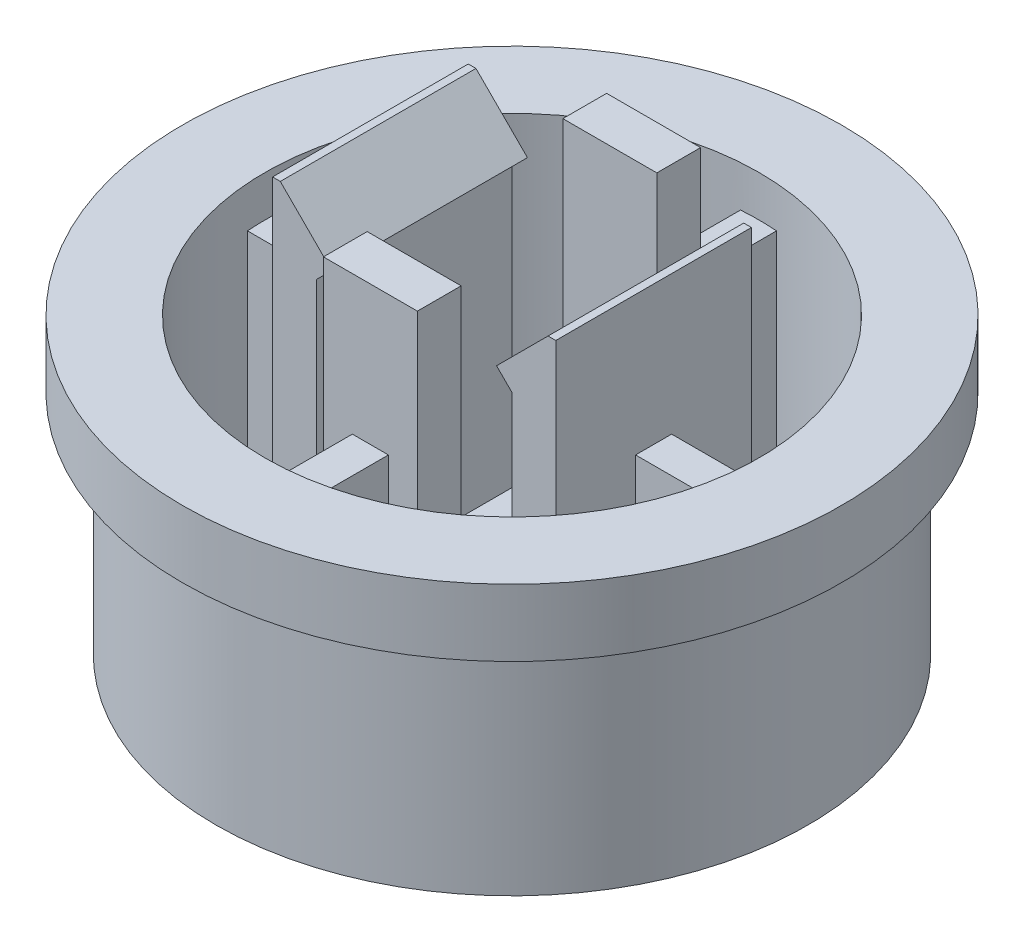
from build123d import *

# Parameters (mm, degrees)
SKETCH_1_R          = 5.75
EXTRUDE_1_DEPTH     = 0.9
SKETCH_2_R          = 5.75
SKETCH_2_R_2        = 4.8
EXTRUDE_2_DEPTH     = 3.5
SKETCH_3_R          = 6.4
SKETCH_3_R_2        = 4.8
EXTRUDE_3_DEPTH     = 1.3
SKETCH_4_W          = 0.85
SKETCH_4_H          = 3.8
SKETCH_4_W_2        = 1.824882422
SKETCH_4_H_2        = 0.85
EXTRUDE_4_DEPTH     = 6.7
EXTRUDE_5_DEPTH     = 3.8
CUT_EXTRUDE_1_REACH = 14.946
EXTRUDE_6_DEPTH     = 4


with BuildPart() as part:
    # Эскиз1 → Бобышка-Вытянуть1 (new body)
    with BuildSketch(Plane(origin=(0, 0, 0), x_dir=(1, 0, 0), z_dir=(0, 1, 0))):
        Circle(SKETCH_1_R)
    extrude(amount=EXTRUDE_1_DEPTH)

    # Эскиз2 → Бобышка-Вытянуть2 (add)
    with BuildSketch(Plane(origin=(0, 0.9, 0), x_dir=(1, 0, 0), z_dir=(0, 1, 0))):
        Circle(SKETCH_2_R)
        Circle(SKETCH_2_R_2, mode=Mode.SUBTRACT)
    extrude(amount=EXTRUDE_2_DEPTH)

    # Эскиз3 → Бобышка-Вытянуть3 (add)
    with BuildSketch(Plane(origin=(0, 4.4, 0), x_dir=(1, 0, 0), z_dir=(0, 1, 0))):
        Circle(SKETCH_3_R)
        Circle(SKETCH_3_R_2, mode=Mode.SUBTRACT)
    extrude(amount=EXTRUDE_3_DEPTH)

    # Эскиз4 → Бобышка-Вытянуть4 (add)
    with BuildSketch(Plane(origin=(0, 0.9, 0), x_dir=(1, 0, 0), z_dir=(0, 1, 0))):
        with Locations((-2.325, 0)):
            Rectangle(SKETCH_4_W, SKETCH_4_H)
        with Locations((2.325, 0)):
            Rectangle(SKETCH_4_W, SKETCH_4_H)
        with Locations((0, 2.325)):
            Rectangle(SKETCH_4_W_2, SKETCH_4_H_2)
        with Locations((0, -2.325)):
            Rectangle(SKETCH_4_W_2, SKETCH_4_H_2)
    extrude(amount=EXTRUDE_4_DEPTH)

    # Эскиз5 → Бобышка-Вытянуть5 (add)
    with BuildSketch(Plane(origin=(0, 0, -1.9), x_dir=(-1, 0, 0), z_dir=(0, 0, -1))):
        Polygon((1.9, 6.3), (1.6, 6.6), (2.6, 7.6), align=None)
        Polygon((-1.9, 6.3), (-1.6, 6.6), (-2.6, 7.6), align=None)
    extrude(amount=-EXTRUDE_5_DEPTH)

    # Эскиз6 → Вырез-Вытянуть1 (cut, up to next)
    with BuildSketch(Plane(origin=(0, 0, -1.9), x_dir=(-1, 0, 0), z_dir=(0, 0, -1)), mode=Mode.PRIVATE) as cut_extrude_1_sk1:
        Polygon((1.9, 6.9), (2.6, 7.6), (1.9, 7.6), align=None)
    cut_extrude_1_tool1 = extrude(cut_extrude_1_sk1.sketch, amount=-CUT_EXTRUDE_1_REACH, mode=Mode.PRIVATE) & part.part
    # Эскиз6 → Вырез-Вытянуть1 (cut, up to next)
    with BuildSketch(Plane(origin=(0, 0, -1.9), x_dir=(-1, 0, 0), z_dir=(0, 0, -1)), mode=Mode.PRIVATE) as cut_extrude_1_sk2:
        Polygon((-1.9, 6.9), (-2.6, 7.6), (-1.9, 7.6), align=None)
    cut_extrude_1_tool2 = extrude(cut_extrude_1_sk2.sketch, amount=-CUT_EXTRUDE_1_REACH, mode=Mode.PRIVATE) & part.part
    add(cut_extrude_1_tool1.solids().sort_by_distance((-2.133333, 7.366667, -1.9))[0], mode=Mode.SUBTRACT)
    add(cut_extrude_1_tool2.solids().sort_by_distance((2.133333, 7.366667, -1.9))[0], mode=Mode.SUBTRACT)

    # Эскиз7 → Бобышка-Вытянуть6 (add)
    with BuildSketch(Plane(origin=(0, 0.9, 0), x_dir=(1, 0, 0), z_dir=(0, 1, 0))):
        with BuildLine():
            Line((-0.35, -2.75), (0.35, -2.75))
            Line((0.35, -2.75), (0.35, -4.787222577))
            ThreePointArc((0.35, -4.787222577), (0, -4.8), (-0.35, -4.787222577))
            Line((-0.35, -4.787222577), (-0.35, -2.75))
        make_face()
        with BuildLine():
            Line((4.787222577, -0.35), (2.75, -0.35))
            Line((2.75, -0.35), (2.75, 0.35))
            Line((2.75, 0.35), (4.787222577, 0.35))
            ThreePointArc((4.787222577, 0.35), (4.8, 0), (4.787222577, -0.35))
        make_face()
        with BuildLine():
            Line((0.35, 2.75), (0.35, 4.787222577))
            ThreePointArc((0.35, 4.787222577), (0, 4.8), (-0.35, 4.787222577))
            Line((-0.35, 4.787222577), (-0.35, 2.75))
            Line((-0.35, 2.75), (0.35, 2.75))
        make_face()
        with BuildLine():
            Line((-2.75, -0.35), (-4.787222577, -0.35))
            ThreePointArc((-4.787222577, -0.35), (-4.8, 0), (-4.787222577, 0.35))
            Line((-4.787222577, 0.35), (-2.75, 0.35))
            Line((-2.75, 0.35), (-2.75, -0.35))
        make_face()
    extrude(amount=EXTRUDE_6_DEPTH)


solid = part.part
